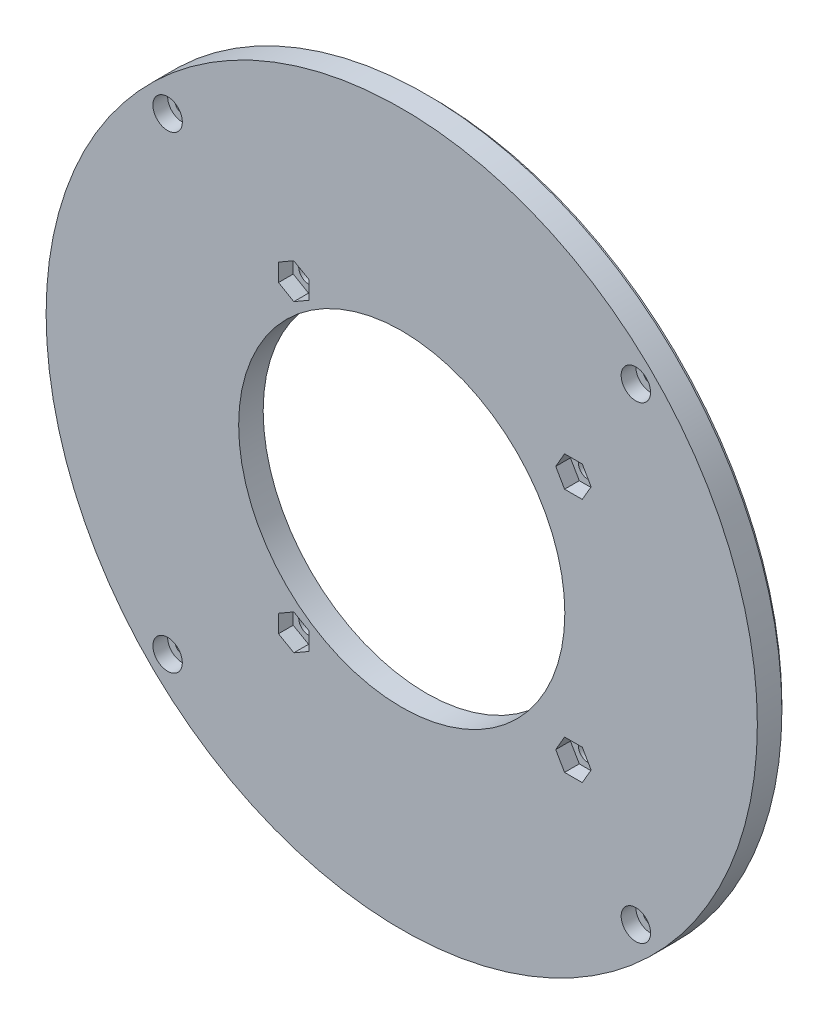
from build123d import *

# Parameters (mm, degrees)
SKIZZE1_R                 = 72.5
SKIZZE1_R_2               = 33.25
LIDAR_TOP_BASE_DEPTH      = 5
LIDAR_SCREWS_D            = 4
SPACER_SCREWS_D           = 3
SPACER_SCREWS_CBORE_D     = 6
SPACER_SCREWS_CBORE_DEPTH = 3
BOTTOM_START              = -4.5
BOTTOM_STRUCTURE_DEPTH    = 4.5
HEX_NUT_DEPTH             = 3
SKIZZE7_R                 = 71.5
SKIZZE7_R_2               = 71
COVER_RING_DEPTH          = 1


with BuildPart() as part:
    # Skizze1 → Lidar Top Base (new body)
    with BuildSketch(Plane.XY):
        Circle(SKIZZE1_R)
        Circle(SKIZZE1_R_2, mode=Mode.SUBTRACT)
    extrude(amount=LIDAR_TOP_BASE_DEPTH)

    # Lidar Screws (through all)
    with Locations(Plane.XY.offset(5)):
        with Locations((-22, 31), (35, 25), (35, -25), (-22, -31)):
            Hole(LIDAR_SCREWS_D / 2)

    # Spacer Screws (through all)
    with Locations(Plane(origin=(0, 0, 5), x_dir=(-1, 0, 0), z_dir=(0, 0, 1))):
        with Locations((47.72970773, -47.72970773), (47.72970773, 47.72970773), (-47.72970773, 47.72970773), (-47.72970773, -47.72970773)):
            CounterBoreHole(SPACER_SCREWS_D / 2, SPACER_SCREWS_CBORE_D / 2, SPACER_SCREWS_CBORE_DEPTH)

    # Skizze6 → Bottom Structure (cut)
    with BuildSketch(Plane(origin=(0, 0, 0), x_dir=(-1, 0, 0), z_dir=(0, 0, -1)).offset(BOTTOM_START)):
        with BuildLine():
            ThreePointArc((-44.67599804, 49.439929098), (-44.256119002, 48.158871274), (-44.351580895, 46.814142832))
            Line((-44.351580895, 46.814142832), (-34.344540081, 28.945931106))
            ThreePointArc((-34.344540081, 28.945931106), (-32.700538124, 28.272991763), (-31.510046068, 26.954538706))
            Line((-31.510046068, 26.954538706), (-29.825905448, 23.947397859))
            ThreePointArc((-29.825905448, 23.947397859), (-7.258760505, 37.554931713), (18.753747138, 33.337058483))
            ThreePointArc((18.753747138, 33.337058483), (20.765145539, 34.804620146), (23.255008426, 34.798019728))
            Line((23.255008426, 34.798019728), (44.31336561, 48.490369623))
            ThreePointArc((44.31336561, 48.490369623), (44.854292699, 49.725199749), (45.821815788, 50.663979077))
            Line((45.821815788, 50.663979077), (47.717721333, 51.896715414))
            ThreePointArc((47.717721333, 51.896715414), (0.745045066, 70.496063066), (-46.61023353, 52.893630338))
            Line((-46.61023353, 52.893630338), (-44.67599804, 49.439929098))
        make_face()
        with BuildLine():
            Line((-38.706982496, 26.502757723), (-48.714023309, 44.370969449))
            ThreePointArc((-48.714023309, 44.370969449), (-49.910490622, 44.992156639), (-50.78341742, 46.019486362))
            Line((-50.78341742, 46.019486362), (-51.795828593, 47.827211296))
            ThreePointArc((-51.795828593, 47.827211296), (-65.657657268, 25.677267029), (-70.5, 0))
            Line((-70.5, 0), (-57.456439237, 0))
            ThreePointArc((-57.456439237, 0), (-42.965235741, -10.431275001), (-37.672530483, 6.621400682))
            ThreePointArc((-37.672530483, 6.621400682), (-36.478038354, 11.507181142), (-34.652808242, 16.193992125))
            Line((-34.652808242, 16.193992125), (-38.489953932, 23.045461294))
            ThreePointArc((-38.489953932, 23.045461294), (-38.992142049, 24.749397), (-38.706982496, 26.502757723))
        make_face()
        with BuildLine():
            ThreePointArc((49.637599672, 44.795436383), (48.387022114, 44.291984966), (47.038925526, 44.298553413))
            Line((47.038925526, 44.298553413), (25.980568343, 30.606203517))
            ThreePointArc((25.980568343, 30.606203517), (25.751268172, 29.611480247), (25.277654247, 28.707188922))
            ThreePointArc((25.277654247, 28.707188922), (34.647475396, 16.205398751), (38.23692587, 1))
            Line((38.23692587, 1), (70.492907445, 1))
            ThreePointArc((70.492907445, 1), (65.727115081, 25.498947882), (52.72387838, 46.802164998))
            Line((52.72387838, 46.802164998), (49.637599672, 44.795436383))
        make_face()
    bottom_structure = extrude(amount=BOTTOM_STRUCTURE_DEPTH, mode=Mode.SUBTRACT)

    # Skizze9 → Hex Nut (cut)
    with BuildSketch(Plane.XY.offset(5)):
        Polygon((-18.875, 32.804219591), (-22, 34.608439182), (-25.125, 32.804219591), (-25.125, 29.195780409), (-22, 27.391560818), (-18.875, 29.195780409), align=None)
        Polygon((38.608439182, 25), (36.804219591, 28.125), (33.195780409, 28.125), (31.391560818, 25), (33.195780409, 21.875), (36.804219591, 21.875), align=None)
    hex_nut = extrude(amount=-HEX_NUT_DEPTH, mode=Mode.SUBTRACT)

    # Structure Mirror: Bottom Structure, Hex Nut across plane
    add(bottom_structure.mirror(Plane.ZX), mode=Mode.SUBTRACT)
    add(hex_nut.mirror(Plane.ZX), mode=Mode.SUBTRACT)

    # Skizze7 → Cover Ring (add)
    with BuildSketch(Plane(origin=(0, 0, 0), x_dir=(-1, 0, 0), z_dir=(0, 0, -1))):
        with Locations(Location((0, 0, 0), (0, 0, 180))):
            Circle(SKIZZE7_R)
        Circle(SKIZZE7_R_2, mode=Mode.SUBTRACT)
    extrude(amount=COVER_RING_DEPTH)


solid = part.part
